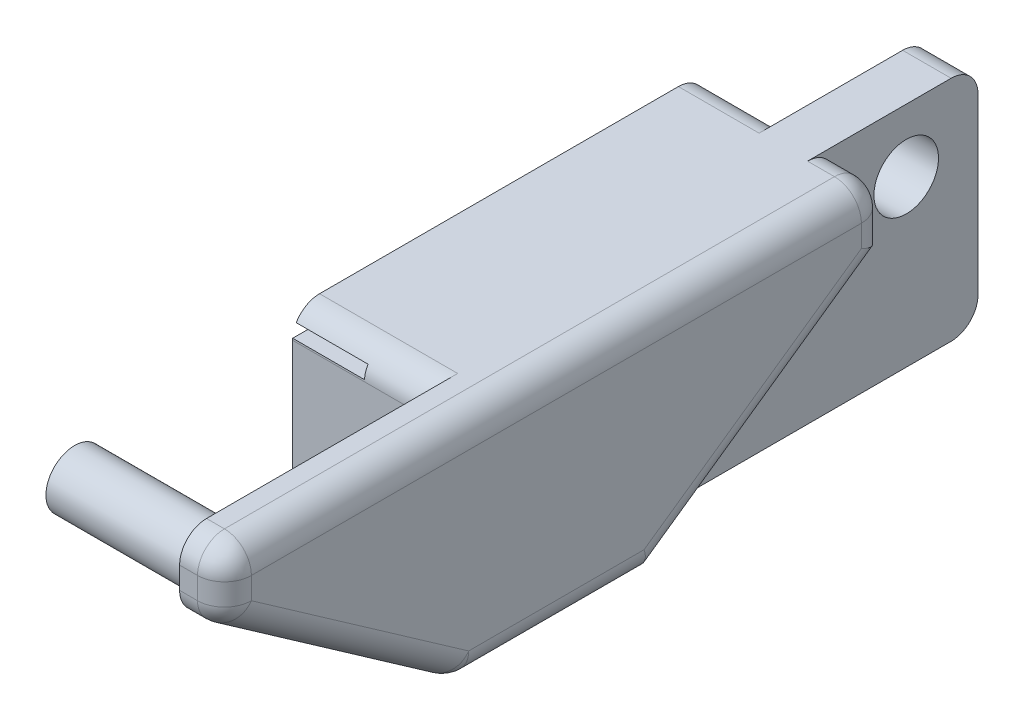
from build123d import *

# Parameters (mm, degrees)
BOSS_EXTRUDE1_DEPTH = 12.7
CUT_EXTRUDE2_DEPTH  = 4.5
CUT_EXTRUDE3_DEPTH  = 32.143608507
BOSS_EXTRUDE2_START = -7.7
SKETCH2_5_R         = 1.6
BOSS_EXTRUDE2_DEPTH = 9.1
SKETCH2_6_R         = 1.8
CUT_EXTRUDE4_DEPTH  = 32.143608507
SKETCH2_7_R         = 1.6
BOSS_EXTRUDE3_DEPTH = 1.4
SKETCH2_8_W         = 45
SKETCH2_8_H         = 0.65
CUT_EXTRUDE5_DEPTH  = 4
CUT_EXTRUDE6_REACH  = 33.63
SKETCH4_W           = 1.5
SKETCH4_H           = 31
CUT_EXTRUDE7_DEPTH  = 3
SKETCH6_W           = 2.1
SKETCH6_H           = 6.861038338
BOSS_EXTRUDE4_DEPTH = 1
CUT_EXTRUDE8_DEPTH  = 4.5
FILLET1_R           = 1.5
FILLET2_R           = 0.25


with BuildPart() as part:
    # Sketch1 → Boss-Extrude1 (new body)
    with BuildSketch(Plane(origin=(0, 0, 0), x_dir=(1, 0, 0), z_dir=(0, 1, 0))):
        Polygon((-28.77817965, 18.54419618), (-24.27817965, 18.54419618), (-24.27817965, 26.54419618), (-21.57817965, 26.54419618), (-21.57817965, 18.54419618), (-18.57817965, 18.54419618), (-18.57817965, -18.45580382), (-21.07817965, -18.45580382), (-21.07817965, -4.45580382), (-28.77817965, -4.45580382), align=None)
    extrude(amount=BOSS_EXTRUDE1_DEPTH)

    # Sketch2 → Cut-Extrude2 (cut)
    with BuildSketch(Plane.ZY.offset(28.77817965)):
        Polygon((-18.54419618, 5.764870839), (-18.54419618, 0), (-7.040359819, 0), align=None)
    extrude(amount=-CUT_EXTRUDE2_DEPTH, mode=Mode.SUBTRACT)

    # Sketch2<4> → Cut-Extrude3 (cut, through all)
    with BuildSketch(Plane.ZY.offset(28.77817965)):
        Polygon((15.124702683, 0), (18.45580382, 0), (18.45580382, 9.2), align=None)
    extrude(amount=-CUT_EXTRUDE3_DEPTH, mode=Mode.SUBTRACT)

    # Sketch2<5> → Boss-Extrude2 (add)
    with BuildSketch(Plane.ZY.offset(28.77817965).offset(BOSS_EXTRUDE2_START)):
        with Locations(Location((15.20580382, 9.2, 0), (0, 0, 180))):
            Circle(SKETCH2_5_R)
    extrude(amount=BOSS_EXTRUDE2_DEPTH)

    # Sketch2<6> → Cut-Extrude4 (cut, through all)
    with BuildSketch(Plane.ZY.offset(28.77817965)):
        with Locations((-22.54419618, 9.2)):
            Circle(SKETCH2_6_R)
    extrude(amount=-CUT_EXTRUDE4_DEPTH, mode=Mode.SUBTRACT)

    # Sketch2<7> → Boss-Extrude3 (add)
    with BuildSketch(Plane.ZY.offset(28.77817965)):
        with Locations(Location((-15.29419618, 9.2, 0), (0, 0, 180))):
            Circle(SKETCH2_7_R)
    extrude(amount=BOSS_EXTRUDE3_DEPTH)

    # Sketch2<8> → Cut-Extrude5 (cut)
    with BuildSketch(Plane.ZY.offset(28.77817965)):
        with Locations((-4.04419618, 11.625)):
            Rectangle(SKETCH2_8_W, SKETCH2_8_H)
    extrude(amount=-CUT_EXTRUDE5_DEPTH, mode=Mode.SUBTRACT)

    # Cut-Extrude6: up to this face of the body (flat: up to its plane)
    cut_extrude6_end = Plane(part.part.faces().sort_by_distance((-21.57817965, 6.032683514, -22.54419618))[0])
    # Sketch3 → Cut-Extrude6 (cut, up to the picked face)
    with BuildSketch(Plane(origin=(-18.57817965, 0, 0), x_dir=(0, 0, -1), z_dir=(1, 0, 0)), mode=Mode.PRIVATE) as cut_extrude6_sk1:
        Polygon((18.54419618, 0), (18.54419618, 9.2), (5.405234518, 0), align=None)
    cut_extrude6_tool1 = split(extrude(cut_extrude6_sk1.sketch, amount=-CUT_EXTRUDE6_REACH, mode=Mode.PRIVATE), bisect_by=cut_extrude6_end, keep=Keep.BOTH, mode=Mode.PRIVATE)
    # Sketch3 → Cut-Extrude6 (cut, up to the picked face)
    with BuildSketch(Plane(origin=(-18.57817965, 0, 0), x_dir=(0, 0, -1), z_dir=(1, 0, 0)), mode=Mode.PRIVATE) as cut_extrude6_sk2:
        Polygon((-15.124702683, 0), (-18.45580382, 9.2), (-18.45580382, 0), align=None)
    cut_extrude6_tool2 = split(extrude(cut_extrude6_sk2.sketch, amount=-CUT_EXTRUDE6_REACH, mode=Mode.PRIVATE), bisect_by=cut_extrude6_end, keep=Keep.BOTH, mode=Mode.PRIVATE)
    # Sketch3 → Cut-Extrude6 (cut, up to the picked face)
    with BuildSketch(Plane(origin=(-18.57817965, 0, 0), x_dir=(0, 0, -1), z_dir=(1, 0, 0)), mode=Mode.PRIVATE) as cut_extrude6_sk3:
        Polygon((-5.316842158, 0), (-18.45580382, 9.2), (-15.124702683, 0), align=None)
    cut_extrude6_tool3 = split(extrude(cut_extrude6_sk3.sketch, amount=-CUT_EXTRUDE6_REACH, mode=Mode.PRIVATE), bisect_by=cut_extrude6_end, keep=Keep.BOTH, mode=Mode.PRIVATE)
    add(cut_extrude6_tool1.solids().sort_by(Axis((-18.57818, 3.066667, -14.164542), (-1, 0, 0)))[0], mode=Mode.SUBTRACT)
    add(cut_extrude6_tool2.solids().sort_by(Axis((-18.57818, 3.066667, 17.345437), (-1, 0, 0)))[0], mode=Mode.SUBTRACT)
    add(cut_extrude6_tool3.solids().sort_by(Axis((-18.57818, 3.066667, 12.965783), (-1, 0, 0)))[0], mode=Mode.SUBTRACT)

    # Sketch4 → Cut-Extrude7 (cut)
    with BuildSketch(Plane.XZ):
        with Locations((-22.92817965, -11.04419618)):
            Rectangle(SKETCH4_W, SKETCH4_H)
    extrude(amount=-CUT_EXTRUDE7_DEPTH, mode=Mode.SUBTRACT)

    # Sketch6 → Boss-Extrude4 (add)
    with BuildSketch(Plane(origin=(0, 0, 0), x_dir=(-1, 0, 0), z_dir=(0, -1, 0))):
        with Locations((22.62817965, -1.025284651)):
            Rectangle(SKETCH6_W, SKETCH6_H)
    extrude(amount=-BOSS_EXTRUDE4_DEPTH)

    # Sketch8 → Cut-Extrude8 (cut)
    with BuildSketch(Plane.ZY.offset(28.77817965)):
        Polygon((-18.54419618, 0), (-7.040359819, 0), (-18.54419618, 5.764870839), align=None)
        Polygon((-7.040359819, 0), (-5.405234518, 0), (-18.54419618, 9.2), (-18.54419618, 5.764870839), align=None)
    extrude(amount=-CUT_EXTRUDE8_DEPTH, mode=Mode.SUBTRACT)

    # Fillet1
    # the kernel refuses this fillet: 1.5 mm, written as the material it takes off along each edge
    with BuildSketch(Plane(origin=(-20.07817965, 9.980850576, 16.95580382), x_dir=(0, 0, 1), z_dir=(1, 0, 0))) as fillet1_piece_1_section:
        Polygon((0, 0), (FILLET1_R, 0), (FILLET1_R, FILLET1_R * 0.520567050552), (FILLET1_R * 0.573576436351, FILLET1_R * 0.819152044289), align=None)
    fillet1_piece_1 = extrude(amount=FILLET1_R, mode=Mode.PRIVATE)
    fillet1_piece_1 = fillet1_piece_1 - Plane(origin=(-20.07817965, 9.980850576, 16.95580382), x_dir=(0, 0.4617486132350316, -0.8870108331782229), z_dir=(1, 0, 0)) * Sphere(FILLET1_R, mode=Mode.PRIVATE)
    add(fillet1_piece_1, mode=Mode.SUBTRACT)
    with BuildSketch(Plane(origin=(-20.07817965, 11.2, 16.95580382), x_dir=(1, 0, 0), z_dir=(0, 1, 0))) as fillet1_piece_2_section:
        Polygon((0, 0), (FILLET1_R, 0), (FILLET1_R, -FILLET1_R), (0, -FILLET1_R), align=None)
    fillet1_piece_2 = extrude(amount=FILLET1_R, mode=Mode.PRIVATE)
    fillet1_piece_2 = fillet1_piece_2 - Plane(origin=(-20.07817965, 11.2, 16.95580382), x_dir=(-0.7071067811865476, 0, -0.7071067811865475), z_dir=(0, 1, 0)) * Sphere(FILLET1_R, mode=Mode.PRIVATE)
    add(fillet1_piece_2, mode=Mode.SUBTRACT)
    with BuildSketch(Plane(origin=(-20.07817965, 1.5, 4.843893974), x_dir=(0, -0.8191520442889888, 0.5735764363510504), z_dir=(1, 0, 0))) as fillet1_piece_3_section:
        Polygon((0, 0), (FILLET1_R, 0), (FILLET1_R, FILLET1_R * 0.315298788879), (FILLET1_R * 0.819152044289, FILLET1_R * 0.573576436351), align=None)
    fillet1_piece_3 = extrude(amount=FILLET1_R, mode=Mode.PRIVATE)
    fillet1_piece_3 = fillet1_piece_3 - Plane(origin=(-20.07817965, 1.5, 4.843893974), x_dir=(0, 0.9537169507482262, -0.3007057995042756), z_dir=(1, 0, 0)) * Sphere(FILLET1_R, mode=Mode.PRIVATE)
    add(fillet1_piece_3, mode=Mode.SUBTRACT)
    with BuildSketch(Plane(origin=(-20.07817965, 11.2, -17.04419618), x_dir=(1, 0, 0), z_dir=(0, 1, 0))) as fillet1_piece_4_section:
        Polygon((0, 0), (FILLET1_R, 0), (FILLET1_R, FILLET1_R), (0, FILLET1_R), align=None)
    fillet1_piece_4 = extrude(amount=FILLET1_R, mode=Mode.PRIVATE)
    fillet1_piece_4 = fillet1_piece_4 - Plane(origin=(-20.07817965, 11.2, -17.04419618), x_dir=(-0.7071067811865475, 0, 0.7071067811865477), z_dir=(0, 1, 0)) * Sphere(FILLET1_R, mode=Mode.PRIVATE)
    add(fillet1_piece_4, mode=Mode.SUBTRACT)
    with BuildSketch(Plane(origin=(-21.07817965, 0, 4.45580382), x_dir=(0, 1, 0), z_dir=(-1, 0, 0))) as fillet1_piece_5:
        with BuildLine():
            CenterArc((FILLET1_R, FILLET1_R), FILLET1_R, 180, 90)
            Line((0, FILLET1_R), (0, 0))
            Line((0, 0), (FILLET1_R, 0))
        make_face()
    extrude(amount=11.45, mode=Mode.SUBTRACT)
    with BuildSketch(Plane(origin=(-21.07817965, 12.7, 4.45580382), x_dir=(0, -1, 0), z_dir=(-1, 0, 0))) as fillet1_piece_6:
        with BuildLine():
            CenterArc((FILLET1_R, -FILLET1_R), FILLET1_R, 90, 90)
            Line((0, -FILLET1_R), (0, 0))
            Line((0, 0), (FILLET1_R, 0))
        make_face()
    extrude(amount=11.45, mode=Mode.SUBTRACT)
    with BuildSketch(Plane(origin=(-25.92817965, 0, -26.54419618), x_dir=(0, 1, 0), z_dir=(1, 0, 0)), Plane(origin=(-28.02817965, 0, -26.54419618), x_dir=(0, 1, 0), z_dir=(1, 0, 0))) as fillet1_piece_7:
        with BuildLine():
            CenterArc((FILLET1_R, FILLET1_R), FILLET1_R, 180, 90)
            Line((0, FILLET1_R), (0, 0))
            Line((0, 0), (FILLET1_R, 0))
        make_face()
    extrude(amount=8.1, mode=Mode.SUBTRACT)
    with BuildSketch(Plane(origin=(-28.02817965, 12.7, -26.54419618), x_dir=(0, -1, 0), z_dir=(1, 0, 0))) as fillet1_piece_8:
        with BuildLine():
            CenterArc((FILLET1_R, -FILLET1_R), FILLET1_R, 90, 90)
            Line((0, -FILLET1_R), (0, 0))
            Line((0, 0), (FILLET1_R, 0))
        make_face()
    extrude(amount=10.2, mode=Mode.SUBTRACT)
    with BuildSketch(Plane(origin=(-18.57817965, 9.980850576, 18.45580382), x_dir=(0, 0, -1), z_dir=(0, 1, 0))) as fillet1_piece_9:
        with BuildLine():
            CenterArc((FILLET1_R, FILLET1_R), FILLET1_R, 180, 90)
            Line((0, FILLET1_R), (0, 0))
            Line((0, 0), (FILLET1_R, 0))
        make_face()
    extrude(amount=1.219149424, mode=Mode.SUBTRACT)
    with BuildSketch(Plane(origin=(-23.03030609, 9.2, 18.45580382), x_dir=(0, 1, 0), z_dir=(1, 0, 0))) as fillet1_piece_10:
        with BuildLine():
            CenterArc((FILLET1_R * 0.520567050552, -FILLET1_R), FILLET1_R, 90, 55)
            Line((-FILLET1_R * 0.298584993737, -FILLET1_R * 0.426423563649), (0, 0))
            Line((0, 0), (FILLET1_R * 0.520567050552, 0))
        make_face()
    extrude(amount=2.95212644, mode=Mode.SUBTRACT)
    with BuildSketch(Plane(origin=(-20.07817965, 12.7, 18.45580382), x_dir=(0, -1, 0), z_dir=(-1, 0, 0))) as fillet1_piece_11:
        with BuildLine():
            CenterArc((FILLET1_R, -FILLET1_R), FILLET1_R, 90, 90)
            Line((0, -FILLET1_R), (0, 0))
            Line((0, 0), (FILLET1_R, 0))
        make_face()
    extrude(amount=4.75, mode=Mode.SUBTRACT)
    with BuildSketch(Plane(origin=(-20.07817965, 0, 5.316842158), x_dir=(0, 0.5735764363510512, 0.8191520442889884), z_dir=(-1, 0, 0))) as fillet1_piece_12:
        with BuildLine():
            CenterArc((FILLET1_R * 0.315298788879, FILLET1_R), FILLET1_R, 235, 35)
            Line((-FILLET1_R * 0.258277647472, FILLET1_R * 0.180847955711), (0, 0))
            Line((0, 0), (FILLET1_R * 0.315298788879, 0))
        make_face()
    extrude(amount=2.182370458, mode=Mode.SUBTRACT)
    with BuildSketch(Plane(origin=(-18.57817965, 0.271271934, 5.704258629), x_dir=(0, 0.8191520442889888, -0.5735764363510504), z_dir=(0, 0.5735764363510504, 0.8191520442889888))) as fillet1_piece_13:
        with BuildLine():
            CenterArc((FILLET1_R, FILLET1_R), FILLET1_R, 180, 90)
            Line((0, FILLET1_R), (0, 0))
            Line((0, 0), (FILLET1_R, 0))
        make_face()
    extrude(amount=14.785911761, mode=Mode.SUBTRACT)
    with BuildSketch(Plane(origin=(-18.57817965, 0, -9.155234518), x_dir=(0, 1, 0), z_dir=(0, 0, 1))) as fillet1_piece_14:
        with BuildLine():
            CenterArc((FILLET1_R, FILLET1_R), FILLET1_R, 180, 90)
            Line((0, FILLET1_R), (0, 0))
            Line((0, 0), (FILLET1_R, 0))
        make_face()
    extrude(amount=13.999128493, mode=Mode.SUBTRACT)
    with BuildSketch(Plane(origin=(-18.57817965, 11.350911636, -21.616016346), x_dir=(-1, 0, 0), z_dir=(0, -0.5735764363510504, 0.8191520442889889))) as fillet1_piece_15:
        with BuildLine():
            CenterArc((FILLET1_R, -FILLET1_R), FILLET1_R, 90, 90)
            Line((0, -FILLET1_R), (0, 0))
            Line((0, 0), (FILLET1_R, 0))
        make_face()
    extrude(amount=23.53971052, mode=Mode.SUBTRACT)
    with BuildSketch(Plane(origin=(-18.57817965, 5.45, -18.54419618), x_dir=(0, 0, 1), z_dir=(0, 1, 0))) as fillet1_piece_16:
        with BuildLine():
            CenterArc((FILLET1_R, -FILLET1_R), FILLET1_R, 90, 90)
            Line((0, -FILLET1_R), (0, 0))
            Line((0, 0), (FILLET1_R, 0))
        make_face()
    extrude(amount=5.75, mode=Mode.SUBTRACT)
    with BuildSketch(Plane(origin=(-32.52817965, 12.7, -18.54419618), x_dir=(0, 0, 1), z_dir=(1, 0, 0))) as fillet1_piece_17:
        with BuildLine():
            CenterArc((FILLET1_R, FILLET1_R), FILLET1_R, 180, 90)
            Line((0, FILLET1_R), (0, 0))
            Line((0, 0), (FILLET1_R, 0))
        make_face()
    extrude(amount=8.25, mode=Mode.SUBTRACT)
    with BuildSketch(Plane(origin=(-32.52817965, 12.7, -18.54419618), x_dir=(0, 0, 1), z_dir=(1, 0, 0))) as fillet1_piece_18_section:
        with BuildLine():
            CenterArc((FILLET1_R, FILLET1_R), FILLET1_R, 180, 90)
            Line((0, FILLET1_R), (0, 0))
            Line((0, 0), (FILLET1_R, 0))
        make_face()
    fillet1_piece_18 = extrude(amount=12, mode=Mode.PRIVATE)
    fillet1_piece_18 = split(fillet1_piece_18, bisect_by=Plane(origin=(-21.57817965, 12.360407329, -18.204603509), z_dir=(1, 0, 0)), keep=Keep.TOP, mode=Mode.PRIVATE)
    add(fillet1_piece_18, mode=Mode.SUBTRACT)
    with BuildSketch(Plane(origin=(-25.32817965, 12.7, -18.54419618), x_dir=(0, -1, 0), z_dir=(1, 0, 0))) as fillet1_piece_19_section:
        with BuildLine():
            CenterArc((FILLET1_R, -FILLET1_R), FILLET1_R, 90, 90)
            Line((0, -FILLET1_R), (0, 0))
            Line((0, 0), (FILLET1_R, 0))
        make_face()
    fillet1_piece_19 = extrude(amount=5.25, mode=Mode.PRIVATE)
    fillet1_piece_19 = split(fillet1_piece_19, bisect_by=Plane(origin=(-24.27817965, 12.360407329, -18.204603509), z_dir=(-1, 0, 0)), keep=Keep.TOP, mode=Mode.PRIVATE)
    add(fillet1_piece_19, mode=Mode.SUBTRACT)
    with BuildSketch(Plane(origin=(-21.57817965, 12.7, -18.54419618), x_dir=(0, -1, 0), z_dir=(1, 0, 0))) as fillet1_piece_20:
        with BuildLine():
            CenterArc((FILLET1_R, -FILLET1_R), FILLET1_R, 90, 90)
            Line((0, -FILLET1_R), (0, 0))
            Line((0, 0), (FILLET1_R, 0))
        make_face()
    extrude(amount=1.5, mode=Mode.SUBTRACT)
    with BuildSketch(Plane(origin=(-18.57817965, 12.7, -17.04419618), x_dir=(0, -1, 0), z_dir=(0, 0, 1))) as fillet1_piece_21:
        with BuildLine():
            CenterArc((FILLET1_R, -FILLET1_R), FILLET1_R, 90, 90)
            Line((0, -FILLET1_R), (0, 0))
            Line((0, 0), (FILLET1_R, 0))
        make_face()
    extrude(amount=34, mode=Mode.SUBTRACT)
    with BuildSketch(Plane(origin=(-29.960550109, 0, -5.405234518), x_dir=(0, 0.5735764363510492, -0.8191520442889897), z_dir=(1, 0, 0))) as fillet1_piece_22:
        with BuildLine():
            CenterArc((FILLET1_R * 0.315298788879, FILLET1_R), FILLET1_R, 235, 35)
            Line((-FILLET1_R * 0.258277647472, FILLET1_R * 0.180847955711), (0, 0))
            Line((0, 0), (FILLET1_R * 0.315298788879, 0))
        make_face()
    extrude(amount=5.682370458, mode=Mode.SUBTRACT)
    with BuildSketch(Plane(origin=(-30.73030609, 9.2, -18.54419618), x_dir=(0, 1, 0), z_dir=(1, 0, 0))) as fillet1_piece_23:
        with BuildLine():
            CenterArc((FILLET1_R * 0.520567050552, FILLET1_R), FILLET1_R, 215, 55)
            Line((-FILLET1_R * 0.298584993737, FILLET1_R * 0.426423563649), (0, 0))
            Line((0, 0), (FILLET1_R * 0.520567050552, 0))
        make_face()
    extrude(amount=6.45212644, mode=Mode.SUBTRACT)

    # Fillet2
    fillet2_edges = [part.edges().sort_by_distance(p)[0] for p in [
        (-22.17817965, 3, -11.04419618),
        (-22.17817965, 2.25, 4.45580382),
        (-22.92817965, 3, -26.54419618),
        (-22.17817965, 2.25, -26.54419618),
        (-23.67817965, 3, -11.04419618),
        (-23.67817965, 2.25, -26.54419618),
        (-22.92817965, 3, 4.45580382),
        (-23.67817965, 2.25, 4.45580382),
        (-23.67817965, 0, -13.724715349),
        (-22.17817965, 0, -13.724715349),
        (-23.67817965, 0.439339828, -26.104856352),
        (-23.67817965, 1.246347032, 4.434201659),
        (-22.17817965, 0.439339828, -26.104856352),
        (-22.17817965, 1.246347032, 4.434201659),
    ]]
    fillet(fillet2_edges, radius=FILLET2_R)


solid = part.part
